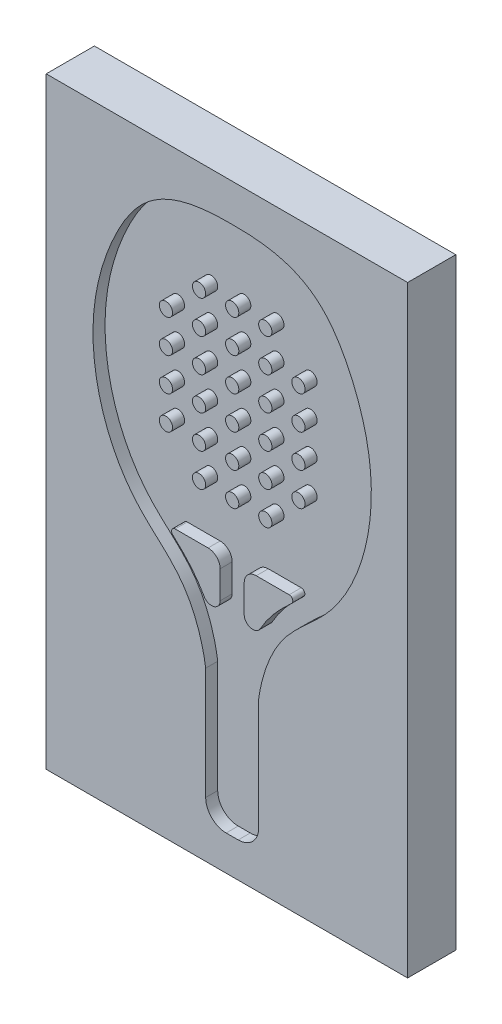
from build123d import *

# Parameters (mm, degrees)
SCHIZZO1_W                   = 300
SCHIZZO1_H                   = 500
ESTRUSIONE_ESTRUSIONE1_DEPTH = 40
CAVIT_1_START                = 30
CAVIT_1_OUTLINE_R            = 5.5
CAVIT_1_DEPTH                = 10


# Read off the part's stored shape, not the designer's step: Cavità1
with BuildPart() as part:
    # Schizzo1 → Estrusione-Estrusione1 (new body)
    with BuildSketch(Plane.XY):
        with Locations((-50, 50)):
            Rectangle(SCHIZZO1_W, SCHIZZO1_H)
    extrude(amount=ESTRUSIONE_ESTRUSIONE1_DEPTH)

    # Cavità1 outline → Cavità1 (cut)
    with BuildSketch(Plane.XY.offset(CAVIT_1_START)):
        with BuildLine():
            add(Edge.make_bspline(
                [(-45.630563704, 268.931224179), (-10.242824482, 269.253777995), (26.207264329, 258.769731776), (61.298997523, 197.395847805), (78.425982638, 121.642243114), (51.329454916, 37.820129659), (-8.296880797, -5.833230992), (-20.792475043, -41.327625634), (-23.630563704, -61.068775821)],
                knots=[0, 0, 0, 0, 0.150070551, 0.226928811, 0.372737193, 0.578941384, 0.665352937, 0.775034733, 0.775034733, 0.775034733, 0.775034733], degree=3))
            add(Edge.make_bspline(
                [(-45.630563704, 268.931224179), (-81.018302926, 269.253777995), (-117.468391737, 258.769731776), (-152.560124931, 197.395847805), (-169.687110046, 121.642243114), (-142.590582324, 37.820129659), (-82.96424661, -5.833230992), (-70.468652365, -41.327625634), (-67.630563704, -61.068775821)],
                knots=[0, 0, 0, 0, 0.150070551, 0.226928811, 0.372737193, 0.578941384, 0.665352937, 0.775034733, 0.775034733, 0.775034733, 0.775034733], degree=3))
            Line((-67.630563704, -61.068775821), (-67.630563704, -154.068775821))
            ThreePointArc((-67.630563704, -154.068775821), (-62.651378984, -166.089591101), (-50.630563704, -171.068775821))
            Line((-50.630563704, -171.068775821), (-40.630563704, -171.068775821))
            ThreePointArc((-40.630563704, -171.068775821), (-28.609748424, -166.089591101), (-23.630563704, -154.068775821))
            Line((-23.630563704, -154.068775821), (-23.630563704, -61.068775821))
        make_face()
        with BuildLine():
            add(Edge.make_bspline(
                [(-94.989572549, 21.153662791), (-94.15142809, 20.375950025), (-89.988702943, 16.48850239), (-84.886613244, 11.470594112), (-79.980862553, 5.858684547), (-76.768963888, 1.916853126), (-72.951216506, -3.363954472), (-70.22044574, -7.792969084), (-68.901941305, -10.109702474)],
                knots=[0.623558075, 0.623558075, 0.623558075, 0.623558075, 0.629715721, 0.653935556, 0.659990515, 0.666045474, 0.678155392, 0.690959257, 0.690959257, 0.690959257, 0.690959257], degree=3))
            ThreePointArc((-94.989572549, 21.153662791), (-95.741625635, 24.448829767), (-92.949014353, 26.352781308))
            Line((-92.949014353, 26.352781308), (-65.630943606, 26.352781308))
            ThreePointArc((-65.630943606, 26.352781308), (-58.559875794, 23.42384912), (-55.630943606, 16.352781308))
            Line((-55.630943606, 16.352781308), (-55.630943606, -6.647312588))
            ThreePointArc((-55.630943606, -6.647312588), (-57.681196138, -11.597060056), (-62.630943606, -13.647312588))
            Line((-62.630943606, -13.647312588), (-62.818204273, -13.647312588))
            ThreePointArc((-62.818204273, -13.647312588), (-66.336959081, -12.69862357), (-68.901941305, -10.109702474))
        make_face(mode=Mode.SUBTRACT)
        with BuildLine():
            ThreePointArc((1.687854421, 26.352781308), (4.480467254, 24.448825814), (3.728406391, 21.153657015))
            add(Edge.make_bspline(
                [(3.728406391, 21.153657015), (2.890265485, 20.375951961), (-1.272467578, 16.488519054), (-6.374568867, 11.470628296), (-11.280339412, 5.858728651), (-14.492251846, 1.916903523), (-18.310034758, -3.363921174), (-21.040833914, -7.792957432), (-22.359358711, -10.109715267)],
                knots=[0.623558123, 0.623558123, 0.623558123, 0.623558123, 0.629715721, 0.653935556, 0.659990515, 0.666045474, 0.678155392, 0.690959399, 0.690959399, 0.690959399, 0.690959399], degree=3))
            ThreePointArc((-22.359358711, -10.109715267), (-24.924340017, -12.69862727), (-28.443088463, -13.647312588))
            Line((-28.443088463, -13.647312588), (-28.630183802, -13.647312588))
            ThreePointArc((-28.630183802, -13.647312588), (-33.57993127, -11.597060056), (-35.630183802, -6.647312588))
            Line((-35.630183802, -6.647312588), (-35.630183802, 16.352781308))
            ThreePointArc((-35.630183802, 16.352781308), (-32.701251613, 23.423849119), (-25.630183802, 26.352781308))
            Line((-25.630183802, 26.352781308), (1.687854421, 26.352781308))
        make_face(mode=Mode.SUBTRACT)
        with Locations((-100.630563704, 98.138648944)):
            Circle(CAVIT_1_OUTLINE_R, mode=Mode.SUBTRACT)
        with Locations((-73.130563704, 70.638648944)):
            Circle(CAVIT_1_OUTLINE_R, mode=Mode.SUBTRACT)
        with Locations((-45.630563704, 70.638648944)):
            Circle(CAVIT_1_OUTLINE_R, mode=Mode.SUBTRACT)
        with Locations((-73.130563704, 98.138648944)):
            Circle(CAVIT_1_OUTLINE_R, mode=Mode.SUBTRACT)
        with Locations((-45.630563704, 98.138648944)):
            Circle(CAVIT_1_OUTLINE_R, mode=Mode.SUBTRACT)
        with Locations((-100.630563704, 125.638648944)):
            Circle(CAVIT_1_OUTLINE_R, mode=Mode.SUBTRACT)
        with Locations((-100.630563704, 153.138648944)):
            Circle(CAVIT_1_OUTLINE_R, mode=Mode.SUBTRACT)
        with Locations((-73.130563704, 125.638648944)):
            Circle(CAVIT_1_OUTLINE_R, mode=Mode.SUBTRACT)
        with Locations((-45.630563704, 125.638648944)):
            Circle(CAVIT_1_OUTLINE_R, mode=Mode.SUBTRACT)
        with Locations((-73.130563704, 153.138648944)):
            Circle(CAVIT_1_OUTLINE_R, mode=Mode.SUBTRACT)
        with Locations((-45.630563704, 153.138648944)):
            Circle(CAVIT_1_OUTLINE_R, mode=Mode.SUBTRACT)
        with Locations((-100.630563704, 180.638648944)):
            Circle(CAVIT_1_OUTLINE_R, mode=Mode.SUBTRACT)
        with Locations((-73.130563704, 180.638648944)):
            Circle(CAVIT_1_OUTLINE_R, mode=Mode.SUBTRACT)
        with Locations((-45.630563704, 180.638648944)):
            Circle(CAVIT_1_OUTLINE_R, mode=Mode.SUBTRACT)
        with Locations((-73.130563704, 208.138648944)):
            Circle(CAVIT_1_OUTLINE_R, mode=Mode.SUBTRACT)
        with Locations((-45.630563704, 208.138648944)):
            Circle(CAVIT_1_OUTLINE_R, mode=Mode.SUBTRACT)
        with Locations((-18.130563704, 70.638648944)):
            Circle(CAVIT_1_OUTLINE_R, mode=Mode.SUBTRACT)
        with Locations((-18.130563704, 98.138648944)):
            Circle(CAVIT_1_OUTLINE_R, mode=Mode.SUBTRACT)
        with Locations((9.369436296, 98.138648944)):
            Circle(CAVIT_1_OUTLINE_R, mode=Mode.SUBTRACT)
        with Locations((-18.130563704, 125.638648944)):
            Circle(CAVIT_1_OUTLINE_R, mode=Mode.SUBTRACT)
        with Locations((-18.130563704, 153.138648944)):
            Circle(CAVIT_1_OUTLINE_R, mode=Mode.SUBTRACT)
        with Locations((9.369436296, 125.638648944)):
            Circle(CAVIT_1_OUTLINE_R, mode=Mode.SUBTRACT)
        with Locations((9.369436296, 153.138648944)):
            Circle(CAVIT_1_OUTLINE_R, mode=Mode.SUBTRACT)
        with Locations((-18.130563704, 180.638648944)):
            Circle(CAVIT_1_OUTLINE_R, mode=Mode.SUBTRACT)
        with Locations((-18.130563704, 208.138648944)):
            Circle(CAVIT_1_OUTLINE_R, mode=Mode.SUBTRACT)
        with Locations((9.369436296, 180.638648944)):
            Circle(CAVIT_1_OUTLINE_R, mode=Mode.SUBTRACT)
    extrude(amount=CAVIT_1_DEPTH, mode=Mode.SUBTRACT)


solid = part.part
